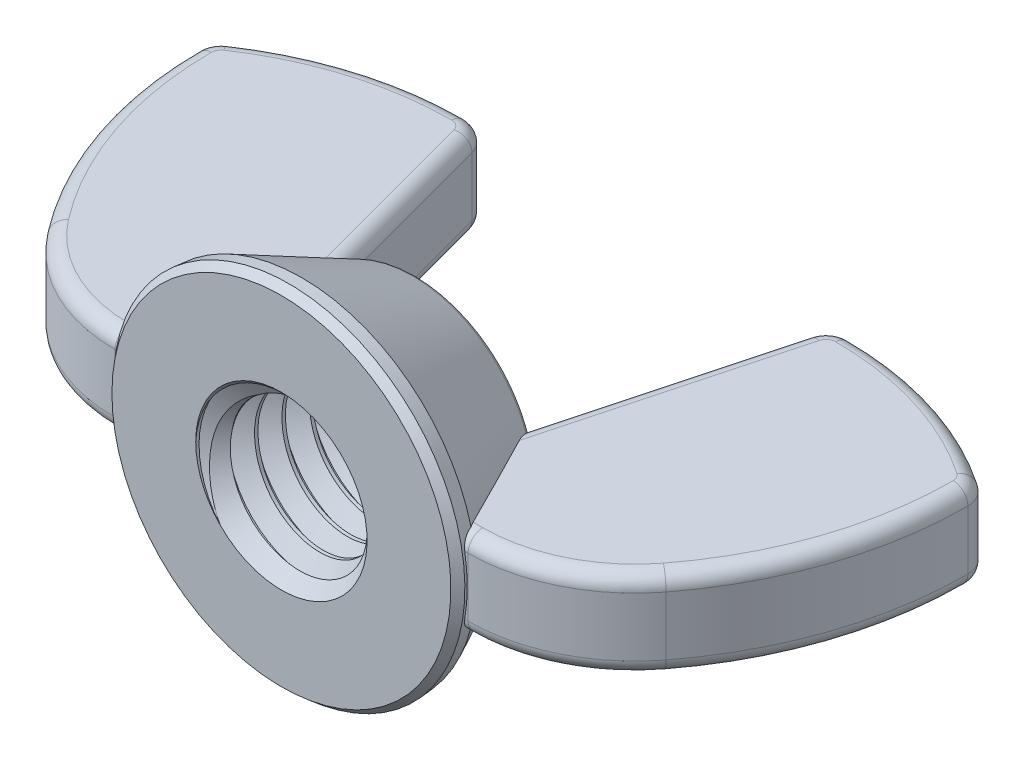
from build123d import *

# Parameters (mm, degrees)
EXTRUDE2_DEPTH     = 1.2875
SKETCH3_R          = 5.15
EXTRUDE1_DEPTH     = 0.594
EXTRUDE1_DRAFT     = -5
SKETCH15_R         = 5.098031734
EXTRUDE3_DEPTH     = 3.366
EXTRUDE3_TAPER     = 25.871291993
FILLET3_R          = 0.254
SKETCH4_R          = 2.5
CUT_EXTRUDE1_DEPTH = 17.555512677
SWEEP1_PITCH       = 0.8
SKETCH7_R          = 5.15
CUT_EXTRUDE2_DEPTH = 17.555512708
SKETCH8_R          = 5.098031734
CUT_EXTRUDE3_DEPTH = 15.235399574
SKETCH11_R         = 2.4492
CUT_EXTRUDE5_DEPTH = 15.235399538
CUT_EXTRUDE5_TAPER = 45
CHAMFER1_SIZE      = 0.22275
CHAMFER1_SIZE2     = 0.205612138
FILLET4_R          = 0.429166667


with BuildPart() as part:
    # Sketch13 → Extrude2 (new, symmetric)
    with BuildSketch(Plane(origin=(0, 0, 0), x_dir=(1, 0, 0), z_dir=(0, 1, 0))):
        with BuildLine():
            Line((3.165877707, 0.297), (5.15, 0.297))
            ThreePointArc((5.15, 0.297), (7.305915719, 0.799490232), (9.017497619, 2.203397788))
            ThreePointArc((9.017497619, 2.203397788), (10.676644326, 5.305484824), (11.25, 8.776360081))
            ThreePointArc((11.25, 8.776360081), (11.166275014, 9.112162658), (10.93470048, 9.369352234))
            ThreePointArc((10.93470048, 9.369352234), (8.389747193, 10.583232684), (5.601091964, 11))
            ThreePointArc((5.601091964, 11), (5.165658442, 10.852190236), (4.910186686, 10.469849734))
            Line((4.910186686, 10.469849734), (3.165877707, 3.96))
            Line((3.165877707, 3.96), (3.165877707, 0.297))
        make_face()
    extrude(amount=EXTRUDE2_DEPTH, both=True)

    # Fillet4
    fillet4_edges = [part.edges().sort_by_distance(p)[0] for p in [
        (7.305915719, 1.2875, -0.799490232),
        (4.157938853, -1.2875, -0.297),
        (10.676644326, 1.2875, -5.305484824),
        (11.166275014, 1.2875, -9.112162658),
        (8.389747193, 1.2875, -10.583232684),
        (5.165658442, 1.2875, -10.852190236),
        (4.038032196, 1.2875, -7.214924867),
        (4.157938853, 1.2875, -0.297),
        (4.038032196, -1.2875, -7.214924867),
        (5.165658442, -1.2875, -10.852190236),
        (8.389747193, -1.2875, -10.583232684),
        (11.166275014, -1.2875, -9.112162658),
        (10.676644326, -1.2875, -5.305484824),
        (7.305915719, -1.2875, -0.799490232),
    ]]
    fillet(fillet4_edges, radius=FILLET4_R)


with BuildPart() as body_2:
    # Sketch3 → Extrude1 (with draft: the straight prism first)
    with BuildSketch(Plane.XY):
        Circle(SKETCH3_R)
    extrude(amount=-EXTRUDE1_DEPTH)
    # Extrude1: the draft: its side faces are tilted about the plane it starts from
    extrude1_sides = [body_2.faces().sort_by_distance(p)[0] for p in [
        (-5.15, 0, -0.297),
    ]]
    draft(extrude1_sides, Plane.XY, EXTRUDE1_DRAFT)

    # Sketch15 → Extrude3 (add)
    with BuildSketch(Plane(origin=(0, 0, -0.594), x_dir=(-1, 0, 0), z_dir=(0, 0, -1))):
        Circle(SKETCH15_R)
    extrude(amount=EXTRUDE3_DEPTH, taper=EXTRUDE3_TAPER)

    # Fillet3
    fillet3_edges = [body_2.edges().sort_by_distance(p)[0] for p in [
        (3.46567363, 0, -3.96),
    ]]
    fillet(fillet3_edges, radius=FILLET3_R)

    # Sketch4 → Cut-Extrude1 (cut, through all)
    with BuildSketch(Plane.XY):
        Circle(SKETCH4_R)
    extrude(amount=-CUT_EXTRUDE1_DEPTH, mode=Mode.SUBTRACT)

    # Sweep1: the profile of Sketch6 profile screwed along a right-hand helix of 7.45 turns, 6 arcs to a turn; built about Z, then put on its axis
    sweep1_z = Axis((0, 0, 0), (0, 0, 1))
    sweep1_corners = [(2.5003, 0, -0.700173205), (1.980384758, 0, -0.4), (1.980384758, 0, -0.3), (2.5003, 0, 0.000173205)]
    with BuildLine(mode=Mode.PRIVATE) as sweep1_profile:
        Line(sweep1_corners[0], sweep1_corners[1])
        Line(sweep1_corners[1], sweep1_corners[2])
        Line(sweep1_corners[2], sweep1_corners[3])
        Line(sweep1_corners[3], sweep1_corners[0])
    sweep1_cap = Face(sweep1_profile.wire())
    sweep1_turn_angles = [0, 30, 60, 90, 120, 150, 180, 210, 240, 270, 300, 330, 360]
    sweep1_turn_weights = [1, 0.8660254037844387, 1, 0.8660254037844387, 1, 0.8660254037844387, 1, 0.8660254037844387, 1, 0.8660254037844387, 1, 0.8660254037844387, 1]
    sweep1_turn_rails = [Edge.make_bspline([Vector(p[0], p[1], 0).rotate(sweep1_z, sweep1_turn_angles[k]) / sweep1_turn_weights[k] + Vector(0, 0, p[2] + SWEEP1_PITCH * sweep1_turn_angles[k] / 360) for k in range(13)], [0, 0, 0, 1, 1, 2, 2, 3, 3, 4, 4, 5, 5, 6, 6, 6], 2, sweep1_turn_weights) for p in sweep1_corners]
    sweep1_turn_sides = [Face.make_surface_from_curves(sweep1_turn_rails[p[0]], sweep1_turn_rails[p[1]]) for p in [(0, 1), (1, 2), (2, 3), (3, 0)]]
    sweep1_last_angles = [2520, 2550, 2580, 2610, 2640, 2661, 2682]
    sweep1_last_weights = [1, 0.8660254037844387, 1, 0.8660254037844387, 1, 0.933580426497169, 1]
    sweep1_last_rails = [Edge.make_bspline([Vector(p[0], p[1], 0).rotate(sweep1_z, sweep1_last_angles[k]) / sweep1_last_weights[k] + Vector(0, 0, p[2] + SWEEP1_PITCH * sweep1_last_angles[k] / 360) for k in range(7)], [0, 0, 0, 1, 1, 2, 2, 3, 3, 3], 2, sweep1_last_weights) for p in sweep1_corners]
    sweep1_last_sides = [Face.make_surface_from_curves(sweep1_last_rails[p[0]], sweep1_last_rails[p[1]]) for p in [(0, 1), (1, 2), (2, 3), (3, 0)]]
    sweep1 = Plane(origin=(0, 0, 0), x_dir=(-1, 0, 0), z_dir=(0, 0, -1)) * Solid(Shell([*[p.moved(Location((0, 0, SWEEP1_PITCH * i))) for i in range(7) for p in sweep1_turn_sides], *sweep1_last_sides, sweep1_cap, sweep1_cap.rotate(sweep1_z, 2682).moved(Location((0, 0, SWEEP1_PITCH * 2682 / 360)))]))
    add(sweep1)

    # Sketch7 → Cut-Extrude2 (cut, through all)
    with BuildSketch(Plane.XY):
        Circle(SKETCH7_R)
    extrude(amount=CUT_EXTRUDE2_DEPTH, mode=Mode.SUBTRACT)

    # Sketch8 → Cut-Extrude3 (cut, through all)
    with BuildSketch(Plane.XY.offset(-3.96)):
        Circle(SKETCH8_R)
    extrude(amount=-CUT_EXTRUDE3_DEPTH, mode=Mode.SUBTRACT)

    # Cut-Extrude4 cone 1 section (through the dimple's axis) → Cut-Extrude4 (revolve, cut)
    with BuildSketch(Plane(origin=(0, 0, 0), x_dir=(0, -1, 0), z_dir=(1, 0, 0))):
        Polygon((0, 0), (2.5, 0), (0, 2.5), align=None)
    revolve(axis=Axis((0, 0, 0), (0, 0, -1)), mode=Mode.SUBTRACT)

    # Sketch11 → Cut-Extrude5 (cut, through all)
    with BuildSketch(Plane.XY.offset(-3.96)):
        Circle(SKETCH11_R)
    extrude(amount=CUT_EXTRUDE5_DEPTH, taper=CUT_EXTRUDE5_TAPER, mode=Mode.SUBTRACT)

    # Chamfer1
    chamfer1_edges = [body_2.edges().sort_by_distance(p)[0] for p in [
        (-5.15, 0, 0),
    ]]
    chamfer1_side = [body_2.faces().sort_by_distance(p)[0] for p in [
        (-5.124015867, 0, -0.297),
    ]]
    chamfer(chamfer1_edges, length=CHAMFER1_SIZE, length2=CHAMFER1_SIZE2, reference=chamfer1_side[0])


with BuildPart() as body_3:
    # Mirror6: mirrored copy
    add(part.part.mirror(Plane(origin=(0, 0, 0), x_dir=(0, 0, 1), z_dir=(1, 0, 0))))

    # Combine2: union part, body 2
    add(part.part)
    add(body_2.part)


solid = body_3.part
